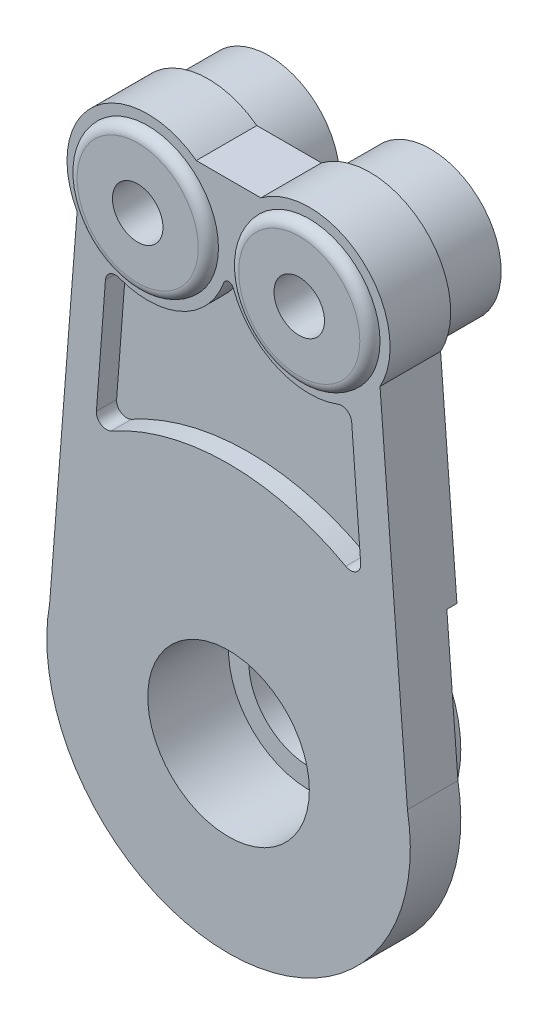
from build123d import *

# Parameters (mm, degrees)
BASE_EXTRUSION_DEPTH    = 3
ESQUISSE2_R             = 3.5
BOSS_EXTRU_1_DEPTH      = 0.5
CONG_1_R                = 0.5
ENL_V_START             = -1
ENL_V_MAT_EXTRU_1_DEPTH = 1
BOSS_EXTRU_2_START      = 3
ESQUISSE5_R             = 3.5
BOSS_EXTRU_2_DEPTH      = 3
ESQUISSE4_R             = 1.25
ENL_V_MAT_EXTRU_3_DEPTH = 28.354158733
ESQUISSE9_R             = 12
ENL_V_MAT_EXTRU_4_DEPTH = 0.5
BOSS_EXTRU_3_START      = 3
BOSS_EXTRU_3_DEPTH      = 3
ESQUISSE12_R            = 4
ENL_V_MAT_EXTRU_5_DEPTH = 4
ESQUISSE13_R            = 3
ENL_V_MAT_EXTRU_6_DEPTH = 27.949025956


with BuildPart() as part:
    # Esquisse1 → Base-Extrusion (new body)
    with BuildSketch(Plane.XY):
        with BuildLine():
            Line((-8.858707286, 1.588491495), (-7.5, 19.063508327))
            ThreePointArc((-7.5, 19.063508327), (-6.626477999, 24.01688802), (-1.6, 24.2))
            Line((-1.6, 24.2), (1.6, 24.2))
            ThreePointArc((1.6, 24.2), (6.626477999, 24.01688802), (7.5, 19.063508327))
            Line((7.5, 19.063508327), (8.858707286, 1.588491495))
            ThreePointArc((8.858707286, 1.588491495), (0, -9), (-8.858707286, 1.588491495))
        make_face()
    extrude(amount=BASE_EXTRUSION_DEPTH)

    # Esquisse2 → Boss.-Extru.1 (add)
    with BuildSketch(Plane.XY.offset(3)):
        with Locations((4, 21)):
            Circle(ESQUISSE2_R)
        with Locations((-4, 21)):
            Circle(ESQUISSE2_R)
    extrude(amount=BOSS_EXTRU_1_DEPTH)

    # Congé1
    cong_1_edges = [part.edges().sort_by_distance(p)[0] for p in [
        (0.5, 21, 3.5),
        (-7.5, 21, 3.5),
    ]]
    fillet(cong_1_edges, radius=CONG_1_R - 0.0001)  # a hair under: the kernel refuses the full size

    # Esquisse3 → Enlèv. mat.-Extru.1 (cut)
    with BuildSketch(Plane.XY.offset(3).offset(ENL_V_START)):
        with BuildLine():
            Line((-6.543725832, 10.97906245), (-6.097110858, 16.831549851))
            ThreePointArc((-6.097110858, 16.831549851), (-5.866577748, 17.215602456), (-5.420942587, 17.260892865))
            ThreePointArc((-5.420942587, 17.260892865), (-2.327193854, 17.366582931), (-0.235294118, 19.648338201))
            ThreePointArc((-0.235294118, 19.648338201), (0, 19.813859338), (0.235294118, 19.648338201))
            ThreePointArc((0.235294118, 19.648338201), (2.327193854, 17.366582931), (5.420942587, 17.260892865))
            ThreePointArc((5.420942587, 17.260892865), (5.866577748, 17.215602456), (6.097110858, 16.831549851))
            Line((6.097110858, 16.831549851), (6.543725832, 10.97906245))
            ThreePointArc((6.543725832, 10.97906245), (6.315450438, 10.520361161), (5.803368369, 10.503376389))
            ThreePointArc((5.803368369, 10.503376389), (0, 12), (-5.803368369, 10.503376389))
            ThreePointArc((-5.803368369, 10.503376389), (-6.315450438, 10.520361161), (-6.543725832, 10.97906245))
        make_face()
    extrude(amount=ENL_V_MAT_EXTRU_1_DEPTH, mode=Mode.SUBTRACT)

    # Esquisse5 → Boss.-Extru.2 (add)
    with BuildSketch(Plane(origin=(0, 0, 0), x_dir=(-1, 0, 0), z_dir=(0, 0, -1)).offset(BOSS_EXTRU_2_START)):
        with Locations(Location((4, 21, 0), (0, 0, 180))):
            Circle(ESQUISSE5_R)
        with Locations(Location((-4, 21, 0), (0, 0, 180))):
            Circle(ESQUISSE5_R)
    extrude(amount=-BOSS_EXTRU_2_DEPTH)

    # Esquisse4 → Enlèv. mat.-Extru.3 (cut, through all)
    with BuildSketch(Plane.XY.offset(3.5)):
        with Locations((4, 21)):
            Circle(ESQUISSE4_R)
        with Locations((-4, 21)):
            Circle(ESQUISSE4_R)
    extrude(amount=-ENL_V_MAT_EXTRU_3_DEPTH, mode=Mode.SUBTRACT)

    # Esquisse9 → Enlèv. mat.-Extru.4 (cut)
    with BuildSketch(Plane(origin=(0, 0, 0), x_dir=(-1, 0, 0), z_dir=(0, 0, -1))):
        Circle(ESQUISSE9_R)
    extrude(amount=-ENL_V_MAT_EXTRU_4_DEPTH, mode=Mode.SUBTRACT)

    # Esquisse11 → Boss.-Extru.3 (add)
    with BuildSketch(Plane(origin=(0, 0, 0.5), x_dir=(-1, 0, 0), z_dir=(0, 0, -1)).offset(BOSS_EXTRU_3_START)):
        with BuildLine():
            Line((1.5, -5.809475019), (1.5, -8.874119675))
            ThreePointArc((1.5, -8.874119675), (0, -9), (-1.5, -8.874119675))
            Line((-1.5, -8.874119675), (-1.5, -5.809475019))
            ThreePointArc((-1.5, -5.809475019), (0, 6), (1.5, -5.809475019))
        make_face()
    extrude(amount=-BOSS_EXTRU_3_DEPTH)

    # Esquisse12 → Enlèv. mat.-Extru.5 (cut)
    with BuildSketch(Plane.XY.offset(3)):
        Circle(ESQUISSE12_R)
    extrude(amount=-ENL_V_MAT_EXTRU_5_DEPTH, mode=Mode.SUBTRACT)

    # Esquisse13 → Enlèv. mat.-Extru.6 (cut, through all)
    with BuildSketch(Plane.XY.offset(-1)):
        Circle(ESQUISSE13_R)
    extrude(amount=-ENL_V_MAT_EXTRU_6_DEPTH, mode=Mode.SUBTRACT)


solid = part.part
